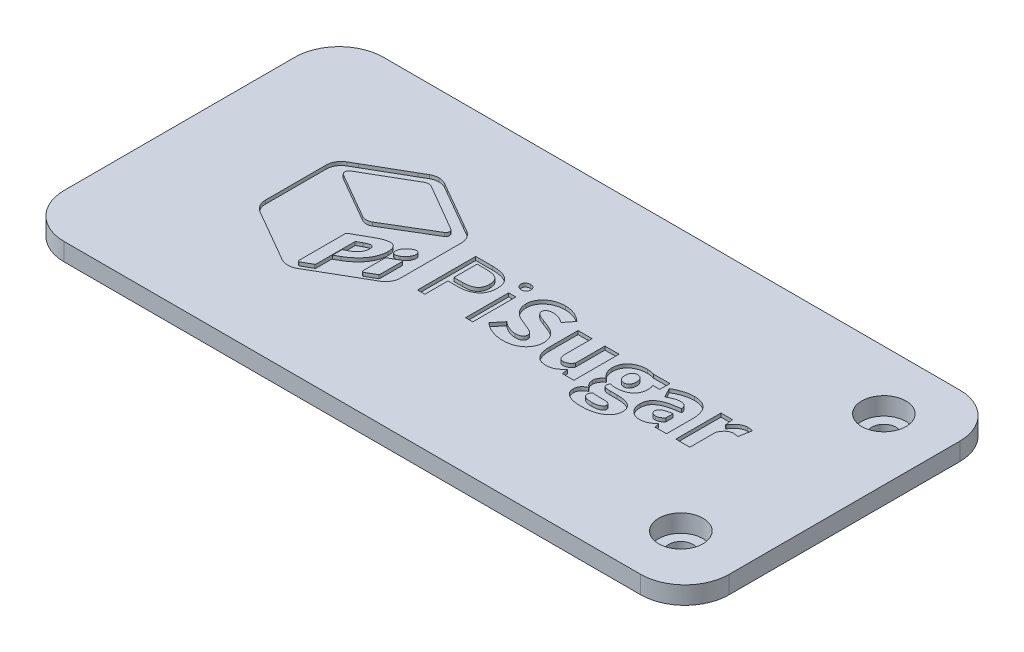
from build123d import *

# Parameters (mm, degrees)
EXTRUDE_2_DEPTH     = 2
EXTRUDE_3_DEPTH     = 1
SKETCH_4_W          = 4
SKETCH_4_H          = 10
EXTRUDE_7_DEPTH     = 2.2
SKETCH_10_R         = 3.5
EXTRUDE_10_DEPTH    = 3
SKETCH_9_R          = 2.5
CUT_EXTRUDE_3_DEPTH = 2
SKETCH_7_R          = 1.375
CUT_EXTRUDE_4_DEPTH = 4
SKETCH_12_W         = 10
SKETCH_12_H         = 1.2
EXTRUDE_11_DEPTH    = 6.7
CHAMFER_5_SIZE      = 1
CHAMFER_6_SIZE      = 1
CHAMFER_8_SIZE      = 1
SKETCH_14_W         = 0.815007944
SKETCH_14_H         = 4.86663949
CUT_EXTRUDE_8_DEPTH = 0.4


with BuildPart() as part:
    # case 2 → 凸台-拉伸2 (new body)
    with BuildSketch(Plane(origin=(0, 0, 0), x_dir=(1, 0, 0), z_dir=(0, 1, 0))):
        with BuildLine():
            Line((-34.042196447, 18), (30.957803553, 18))
            ThreePointArc((30.957803553, 18), (34.493337459, 16.535533906), (35.957803553, 13))
            Line((35.957803553, 13), (35.957803553, -13))
            ThreePointArc((35.957803553, -13), (34.493337459, -16.535533906), (30.957803553, -18))
            Line((30.957803553, -18), (-34.042196447, -18))
            ThreePointArc((-34.042196447, -18), (-37.577730353, -16.535533906), (-39.042196447, -13))
            Line((-39.042196447, -13), (-39.042196447, 13))
            ThreePointArc((-39.042196447, 13), (-37.577730353, 16.535533906), (-34.042196447, 18))
        make_face()
    extrude(amount=EXTRUDE_2_DEPTH)

    # 草图2 → 凸台-拉伸3 (add)
    with BuildSketch(Plane(origin=(0, 0, 0), x_dir=(1, 0, 0), z_dir=(0, 1, 0))):
        with BuildLine():
            Line((33.857803553, -13), (33.857803553, 13))
            ThreePointArc((33.857803553, 13), (32.913005401, 14.955201848), (30.957803553, 15.9))
            Line((30.957803553, 15.9), (-34.042196447, 15.9))
            ThreePointArc((-34.042196447, 15.9), (-35.997398295, 14.955201848), (-36.942196447, 13))
            Line((-36.942196447, 13), (-36.942196447, -13))
            ThreePointArc((-36.942196447, -13), (-35.997398295, -14.955201848), (-34.042196447, -15.9))
            Line((-34.042196447, -15.9), (30.957803553, -15.9))
            ThreePointArc((30.957803553, -15.9), (32.913005401, -14.955201848), (33.857803553, -13))
        make_face()
        with BuildLine():
            Line((-34.042196447, -14.7), (30.957803553, -14.7))
            ThreePointArc((30.957803553, -14.7), (32.036016745, -14.078213193), (32.657803553, -13))
            Line((32.657803553, -13), (32.657803553, 13))
            ThreePointArc((32.657803553, 13), (32.036016745, 14.078213193), (30.957803553, 14.7))
            Line((30.957803553, 14.7), (-34.042196447, 14.7))
            ThreePointArc((-34.042196447, 14.7), (-35.12040964, 14.078213193), (-35.742196447, 13))
            Line((-35.742196447, 13), (-35.742196447, -13))
            ThreePointArc((-35.742196447, -13), (-35.12040964, -14.078213193), (-34.042196447, -14.7))
        make_face(mode=Mode.SUBTRACT)
    extrude(amount=-EXTRUDE_3_DEPTH)

    # 草图4 → 凸台-拉伸7 (add)
    with BuildSketch(Plane(origin=(0, 0, 0), x_dir=(1, 0, 0), z_dir=(0, 1, 0))):
        with Locations((-33.742196447, 0)):
            Rectangle(SKETCH_4_W, SKETCH_4_H)
    extrude(amount=-EXTRUDE_7_DEPTH)

    # 草图10 → 凸台-拉伸10 (add)
    with BuildSketch(Plane(origin=(0, 2, 0), x_dir=(1, 0, 0), z_dir=(0, 1, 0))):
        with Locations((28.997803553, 11.4)):
            Circle(SKETCH_10_R)
        with Locations((28.997803553, -11.5)):
            Circle(SKETCH_10_R)
    extrude(amount=-EXTRUDE_10_DEPTH)

    # 草图9 → 切除-拉伸3 (cut)
    with BuildSketch(Plane(origin=(0, 2, 0), x_dir=(1, 0, 0), z_dir=(0, 1, 0))):
        with Locations((28.997803553, 11.4)):
            Circle(SKETCH_9_R)
        with Locations((28.997803553, -11.5)):
            Circle(SKETCH_9_R)
    extrude(amount=-CUT_EXTRUDE_3_DEPTH, mode=Mode.SUBTRACT)

    # 草图7 → 切除-拉伸4 (cut)
    with BuildSketch(Plane(origin=(0, 2, 0), x_dir=(1, 0, 0), z_dir=(0, 1, 0))):
        with Locations((28.997803553, 11.4)):
            Circle(SKETCH_7_R)
        with Locations((28.997803553, -11.5)):
            Circle(SKETCH_7_R)
    extrude(amount=-CUT_EXTRUDE_4_DEPTH, mode=Mode.SUBTRACT)

    # 草图12 → 凸台-拉伸11 (add)
    with BuildSketch(Plane(origin=(-31.742196447, 0, 0), x_dir=(0, 0, -1), z_dir=(1, 0, 0))):
        with Locations((0, -1.6)):
            Rectangle(SKETCH_12_W, SKETCH_12_H)
    extrude(amount=-EXTRUDE_11_DEPTH)

    # 倒角5
    chamfer_5_edges = [part.edges().sort_by_distance(p)[0] for p in [
        (-38.442196447, -1, 0),
    ]]
    chamfer(chamfer_5_edges, length=CHAMFER_5_SIZE)

    # 倒角6
    chamfer_6_edges = [part.edges().sort_by_distance(p)[0] for p in [
        (-33.742196447, 0, -5),
        (-31.742196447, 0, 0),
        (-33.742196447, 0, 5),
    ]]
    chamfer(chamfer_6_edges, length=CHAMFER_6_SIZE)

    # 倒角8
    chamfer_8_edges = [part.edges().sort_by_distance(p)[0] for p in [
        (-31.742196447, -2.2, 0),
    ]]
    chamfer(chamfer_8_edges, length=CHAMFER_8_SIZE)

    # 草图14 → 切除-拉伸8 (cut)
    # profile 1 of 9: a face of its own
    with BuildSketch(Plane(origin=(0, 2, 0), x_dir=(1, 0, 0), z_dir=(0, 1, 0))):
        with BuildLine():
            Line((-12.368120344, 5.71891476), (-13.188693381, 6.191912926))
            Line((-13.188693381, 6.191912926), (-17.445572533, 8.648032164))
            Line((-17.445572533, 8.648032164), (-18.26614557, 9.126734551))
            add(Edge.make_bspline(
                [(-18.26614557, 9.126734551), (-18.534035259, 9.274870384), (-18.830306925, 9.354659912), (-19.126648154, 9.354659912)],
                knots=[3, 3, 3, 3, 4, 4, 4, 4], degree=3))
            add(Edge.make_bspline(
                [(-19.126648154, 9.354659912), (-19.422989383, 9.354659912), (-19.719330613, 9.274870384), (-19.987150738, 9.126734551)],
                knots=[4, 4, 4, 4, 5, 5, 5, 5], degree=3))
            Line((-19.987150738, 9.126734551), (-20.807793339, 8.648032164))
            Line((-20.807793339, 8.648032164), (-25.06467249, 6.191912926))
            Line((-25.06467249, 6.191912926), (-25.885315091, 5.71891476))
            add(Edge.make_bspline(
                [(-25.885315091, 5.71891476), (-26.415251121, 5.411199871), (-26.745817675, 4.841334295), (-26.745817675, 4.231573956)],
                knots=[8, 8, 8, 8, 9, 9, 9, 9], degree=3))
            Line((-26.745817675, 4.231573956), (-26.745817675, -2.584030844))
            add(Edge.make_bspline(
                [(-26.745817675, -2.584030844), (-26.745817675, -3.199460623), (-26.415251121, -3.763656759), (-25.885315091, -4.071371648)],
                knots=[10, 10, 10, 10, 11, 11, 11, 11], degree=3))
            Line((-25.885315091, -4.071371648), (-25.06467249, -4.544369814))
            Line((-25.06467249, -4.544369814), (-20.807793339, -7.000489052))
            Line((-20.807793339, -7.000489052), (-19.987150738, -7.479156657))
            add(Edge.make_bspline(
                [(-19.987150738, -7.479156657), (-19.719330613, -7.633031493), (-19.422989383, -7.7071168), (-19.126648154, -7.7071168)],
                knots=[14, 14, 14, 14, 15, 15, 15, 15], degree=3))
            add(Edge.make_bspline(
                [(-19.126648154, -7.7071168), (-18.830306925, -7.7071168), (-18.534035259, -7.633031493), (-18.26614557, -7.479156657)],
                knots=[15, 15, 15, 15, 16, 16, 16, 16], degree=3))
            Line((-18.26614557, -7.479156657), (-17.445572533, -7.000489052))
            Line((-17.445572533, -7.000489052), (-13.188693381, -4.544369814))
            Line((-13.188693381, -4.544369814), (-12.368120344, -4.071371648))
            add(Edge.make_bspline(
                [(-12.368120344, -4.071371648), (-11.83241053, -3.763656759), (-11.50761776, -3.199460623), (-11.50761776, -2.584030844)],
                knots=[19, 19, 19, 19, 20, 20, 20, 20], degree=3))
            Line((-11.50761776, -2.584030844), (-11.50761776, 4.231573956))
            add(Edge.make_bspline(
                [(-11.50761776, 4.231573956), (-11.50761776, 4.841334295), (-11.83241053, 5.411199871), (-12.368120344, 5.71891476)],
                knots=[21, 21, 21, 21, 22, 22, 22, 22], degree=3))
        make_face()
        with BuildLine():
            Line((-24.791148144, 5.040773334), (-19.525595795, 8.083870809))
            add(Edge.make_bspline(
                [(-19.525595795, 8.083870809), (-19.280522989, 8.226337203), (-18.972773318, 8.226337203), (-18.722065856, 8.083870809)],
                knots=[3, 3, 3, 3, 4, 4, 4, 4], degree=3))
            Line((-18.722065856, 8.083870809), (-13.485034611, 5.035069113))
            add(Edge.make_bspline(
                [(-13.485034611, 5.035069113), (-13.217214486, 4.881229059), (-13.211510265, 4.493724642), (-13.47933039, 4.334145586)],
                knots=[5, 5, 5, 5, 6, 6, 6, 6], degree=3))
            Line((-13.47933039, 4.334145586), (-18.56819102, 1.291082892))
            add(Edge.make_bspline(
                [(-18.56819102, 1.291082892), (-18.910166017, 1.091609072), (-19.337565198, 1.091609072), (-19.67947063, 1.291082892)],
                knots=[7, 7, 7, 7, 8, 8, 8, 8], degree=3))
            add(Edge.make_bspline(
                [(-19.67947063, 1.291082892), (-24.831008126, 4.265764499), (-24.842416568, 4.27146872)],
                knots=[0, 0, 0, 1, 1, 1], degree=2))
            add(Edge.make_bspline(
                [(-24.842416568, 4.27146872), (-25.110236693, 4.465203538), (-25.081785153, 4.875524839), (-24.791148144, 5.040773334)],
                knots=[1, 1, 1, 1, 2, 2, 2, 2], degree=3))
        make_face(mode=Mode.SUBTRACT)
        with BuildLine():
            Line((-16.989652247, -3.866228388), (-17.582334706, -4.196725379))
            Line((-17.582334706, -4.196725379), (-17.582334706, -3.114001655))
            Line((-17.582334706, -3.114001655), (-17.058102897, -2.851850969))
            add(Edge.make_bspline(
                [(-16.100698123, -1.467081796), (-16.100698123, -2.008461048), (-16.40837823, -2.487128654), (-17.058102897, -2.851850969)],
                knots=[0, 0, 0, 0, 1, 1, 1, 1], degree=3))
            add(Edge.make_bspline(
                [(-17.092258659, -1.279016417), (-16.454011997, -0.914328883), (-16.100698123, -0.908624662), (-16.100698123, -1.467081796)],
                knots=[6, 6, 6, 6, 7, 7, 7, 7], degree=3))
            Line((-17.092258659, -1.279016417), (-17.582334706, -1.552575545))
            add(Edge.make_bspline(
                [(-17.639376914, -1.649442953), (-17.639376914, -1.609548189), (-17.616560031, -1.569653425), (-17.582334706, -1.552575545)],
                knots=[4, 4, 4, 4, 5, 5, 5, 5], degree=3))
            Line((-17.639376914, -1.649442953), (-17.639376914, -2.994317363))
            Line((-17.639376914, -2.994317363), (-17.639376914, -4.29362757))
            Line((-17.639376914, -4.29362757), (-17.639376914, -6.003224295))
            add(Edge.make_bspline(
                [(-17.639376914, -6.003224295), (-17.639376914, -6.043119059), (-17.656420013, -6.077309603), (-17.696279995, -6.100091704)],
                knots=[3, 3, 3, 3, 4, 4, 4, 4], degree=3))
            Line((-17.696279995, -6.100091704), (-18.801855384, -6.726929924))
            add(Edge.make_bspline(
                [(-18.801855384, -6.726929924), (-18.875940691, -6.766824688), (-18.967138661, -6.715556264), (-18.967138661, -6.630062515)],
                knots=[5, 5, 5, 5, 6, 6, 6, 6], degree=3))
            Line((-18.967138661, -6.630062515), (-18.967138661, -1.353101724))
            add(Edge.make_bspline(
                [(-18.967138661, -1.353101724), (-18.967138661, -1.31320696), (-18.950025999, -1.273312196), (-18.910166017, -1.256234315)],
                knots=[7, 7, 7, 7, 8, 8, 8, 8], degree=3))
            Line((-18.910166017, -1.256234315), (-17.029581793, -0.190588472))
            add(Edge.make_bspline(
                [(-17.029581793, -0.190588472), (-15.810061115, 0.498961395), (-14.80145748, 0.635723568), (-14.80145748, -0.731967725)],
                knots=[9, 9, 9, 9, 10, 10, 10, 10], degree=3))
            add(Edge.make_bspline(
                [(-14.80145748, -0.731967725), (-14.80145748, -2.048355812), (-15.821469556, -3.205164843), (-16.989652247, -3.866228388)],
                knots=[10, 10, 10, 10, 11, 11, 11, 11], degree=3))
        make_face(mode=Mode.SUBTRACT)
        with BuildLine():
            Line((-13.086156534, -3.512914514), (-14.180253917, -4.134048514))
            add(Edge.make_bspline(
                [(-14.180253917, -4.134048514), (-14.254339225, -4.173943278), (-14.345537194, -4.122640072), (-14.345537194, -4.037181105)],
                knots=[2, 2, 2, 2, 3, 3, 3, 3], degree=3))
            Line((-14.345537194, -4.037181105), (-14.345537194, -1.52405444))
            add(Edge.make_bspline(
                [(-14.345537194, -1.52405444), (-14.345537194, -1.484194458), (-14.322720311, -1.449969133), (-14.288494986, -1.427187031)],
                knots=[4, 4, 4, 4, 5, 5, 5, 5], degree=3))
            Line((-14.288494986, -1.427187031), (-13.194397602, -0.811722471))
            add(Edge.make_bspline(
                [(-13.194397602, -0.811722471), (-13.120312295, -0.771862489), (-13.029114325, -0.823130913), (-13.029114325, -0.908624662)],
                knots=[6, 6, 6, 6, 7, 7, 7, 7], degree=3))
            Line((-13.029114325, -0.908624662), (-13.029114325, -3.416012324))
            add(Edge.make_bspline(
                [(-13.029114325, -3.416012324), (-13.029114325, -3.455907088), (-13.051931209, -3.495801852), (-13.086156534, -3.512914514)],
                knots=[0, 0, 0, 0, 1, 1, 1, 1], degree=3))
        make_face(mode=Mode.SUBTRACT)
        with BuildLine():
            add(Edge.make_bspline(
                [(-13.684473649, 0.85797949), (-13.245666026, 1.108721734), (-12.932281698, 1.000445884), (-12.932281698, 0.601533025), (-12.932281698, 0.208324387), (-13.245666026, -0.253265338), (-13.684473649, -0.498303361)],
                knots=[2, 2, 2, 2, 3, 3, 3, 4, 4, 4, 4], degree=3))
            add(Edge.make_bspline(
                [(-13.684473649, -0.498303361), (-14.12891593, -0.754749827), (-14.442369821, -0.646473976), (-14.442369821, -0.253265338), (-14.442369821, 0.151351742), (-14.12891593, 0.607237246), (-13.684473649, 0.85797949)],
                knots=[0, 0, 0, 0, 1, 1, 1, 2, 2, 2, 2], degree=3))
        make_face(mode=Mode.SUBTRACT)
    # profile 2 of 9: a face of its own
    with BuildSketch(Plane(origin=(0, 2, 0), x_dir=(1, 0, 0), z_dir=(0, 1, 0))):
        with BuildLine():
            Line((-7.512854513, 3.752871569), (-9.387734516, 3.752871569))
            Line((-9.387734516, 3.752871569), (-9.387734516, -2.811956205))
            Line((-9.387734516, -2.811956205), (-8.555683473, -2.811956205))
            Line((-8.555683473, -2.811956205), (-8.555683473, -0.207666353))
            Line((-8.555683473, -0.207666353), (-7.467220746, -0.207666353))
            add(Edge.make_bspline(
                [(-7.467220746, -0.207666353), (-6.036852588, -0.207666353), (-5.050996273, 0.441953969), (-5.050996273, 1.826757924)],
                knots=[5, 5, 5, 5, 6, 6, 6, 6], degree=3))
            add(Edge.make_bspline(
                [(-5.050996273, 1.826757924), (-5.050996273, 3.262795522), (-6.036852588, 3.752871569), (-7.512854513, 3.752871569)],
                knots=[6, 6, 6, 6, 7, 7, 7, 7], degree=3))
        make_face()
        with BuildLine():
            Line((-7.575461815, 0.464770852), (-8.555683473, 0.464770852))
            Line((-8.555683473, 0.464770852), (-8.555683473, 3.080434364))
            Line((-8.555683473, 3.080434364), (-7.60968714, 3.080434364))
            add(Edge.make_bspline(
                [(-7.60968714, 3.080434364), (-6.458547548, 3.080434364), (-5.877273531, 2.778423696), (-5.877273531, 1.826757924)],
                knots=[3, 3, 3, 3, 4, 4, 4, 4], degree=3))
            add(Edge.make_bspline(
                [(-5.877273531, 1.826757924), (-5.877273531, 0.886465812), (-6.418687566, 0.464770852), (-7.575461815, 0.464770852)],
                knots=[4, 4, 4, 4, 5, 5, 5, 5], degree=3))
        make_face(mode=Mode.SUBTRACT)
    # profile 3 of 9: a face of its own
    with BuildSketch(Plane(origin=(0, 2, 0), x_dir=(1, 0, 0), z_dir=(0, 1, 0))):
        with Locations((-3.56650758, -0.37863646)):
            Rectangle(SKETCH_14_W, SKETCH_14_H)
    # profile 4 of 9: a face of its own
    with BuildSketch(Plane(origin=(0, 2, 0), x_dir=(1, 0, 0), z_dir=(0, 1, 0))):
        with BuildLine():
            Line((1.548022045, 0.977629), (0.716040565, 1.308160773))
            add(Edge.make_bspline(
                [(0.716040565, 1.308160773), (0.129062328, 1.541825137), (-0.292632633, 1.68429153), (-0.292632633, 2.054683285)],
                knots=[1, 1, 1, 1, 2, 2, 2, 2], degree=3))
            add(Edge.make_bspline(
                [(-0.292632633, 2.054683285), (-0.292632633, 2.407997159), (0.009412817, 2.60747098), (0.505193085, 2.60747098)],
                knots=[2, 2, 2, 2, 3, 3, 3, 3], degree=3))
            add(Edge.make_bspline(
                [(0.505193085, 2.60747098), (1.023720673, 2.60747098), (1.434076755, 2.430814043), (1.872814814, 2.094578049)],
                knots=[3, 3, 3, 3, 4, 4, 4, 4], degree=3))
            Line((1.872814814, 2.094578049), (2.670710096, 3.097547027))
            add(Edge.make_bspline(
                [(2.670710096, 3.097547027), (2.089436079, 3.684490482), (1.274497699, 3.980831712), (0.505193085, 3.980831712)],
                knots=[5, 5, 5, 5, 6, 6, 6, 6], degree=3))
            add(Edge.make_bspline(
                [(0.505193085, 3.980831712), (-0.913766632, 3.980831712), (-1.916735609, 3.080434364), (-1.916735609, 1.963520097)],
                knots=[6, 6, 6, 6, 7, 7, 7, 7], degree=3))
            add(Edge.make_bspline(
                [(-1.916735609, 1.963520097), (-1.916735609, 0.994741663), (-1.261445849, 0.413467646), (-0.560452758, 0.134239079)],
                knots=[7, 7, 7, 7, 8, 8, 8, 8], degree=3))
            Line((-0.560452758, 0.134239079), (0.288641384, -0.224779016))
            add(Edge.make_bspline(
                [(0.288641384, -0.224779016), (0.858506959, -0.464112818), (1.228933496, -0.589501331), (1.228933496, -0.977005749)],
                knots=[9, 9, 9, 9, 10, 10, 10, 10], degree=3))
            add(Edge.make_bspline(
                [(1.228933496, -0.977005749), (1.228933496, -1.336023843), (0.949704929, -1.558244984), (0.35702247, -1.558244984)],
                knots=[10, 10, 10, 10, 11, 11, 11, 11], degree=3))
            add(Edge.make_bspline(
                [(0.35702247, -1.558244984), (-0.167209338, -1.558244984), (-0.788412901, -1.279016417), (-1.261445849, -0.874434119)],
                knots=[11, 11, 11, 11, 12, 12, 12, 12], degree=3))
            Line((-1.261445849, -0.874434119), (-2.167443072, -1.979974726))
            add(Edge.make_bspline(
                [(-2.167443072, -1.979974726), (-1.477927986, -2.612517167), (-0.543409659, -2.937344718), (0.322797145, -2.937344718)],
                knots=[13, 13, 13, 13, 14, 14, 14, 14], degree=3))
            add(Edge.make_bspline(
                [(0.322797145, -2.937344718), (1.935561244, -2.937344718), (2.870079571, -1.962862063), (2.870079571, -0.851617235)],
                knots=[14, 14, 14, 14, 15, 15, 15, 15], degree=3))
            add(Edge.make_bspline(
                [(2.870079571, -0.851617235), (2.870079571, 0.088640094), (2.374368867, 0.64713201), (1.548022045, 0.977629)],
                knots=[15, 15, 15, 15, 16, 16, 16, 16], degree=3))
        make_face()
    # profile 5 of 9: a face of its own
    with BuildSketch(Plane(origin=(0, 2, 0), x_dir=(1, 0, 0), z_dir=(0, 1, 0))):
        with BuildLine():
            Line((6.654064901, 2.282643428), (6.654064901, -1.056795277))
            add(Edge.make_bspline(
                [(6.654064901, -1.056795277), (6.386244776, -1.432891252), (6.163919291, -1.575357646), (5.80497076, -1.575357646)],
                knots=[1, 1, 1, 1, 2, 2, 2, 2], degree=3))
            add(Edge.make_bspline(
                [(5.80497076, -1.575357646), (5.400318898, -1.575357646), (5.212288301, -1.375918608), (5.212288301, -0.669256078)],
                knots=[2, 2, 2, 2, 3, 3, 3, 3], degree=3))
            Line((5.212288301, -0.669256078), (5.212288301, 2.282643428))
            Line((5.212288301, 2.282643428), (3.622341086, 2.282643428))
            Line((3.622341086, 2.282643428), (3.622341086, -0.868729898))
            add(Edge.make_bspline(
                [(3.622341086, -0.868729898), (3.622341086, -2.139519), (4.095374034, -2.937344718), (5.20658408, -2.937344718)],
                knots=[6, 6, 6, 6, 7, 7, 7, 7], degree=3))
            add(Edge.make_bspline(
                [(5.20658408, -2.937344718), (5.901803387, -2.937344718), (6.380540556, -2.612517167), (6.802235516, -2.111032678)],
                knots=[7, 7, 7, 7, 8, 8, 8, 8], degree=3))
            Line((6.802235516, -2.111032678), (6.836391277, -2.111032678))
            Line((6.836391277, -2.111032678), (6.950406131, -2.811956205))
            Line((6.950406131, -2.811956205), (8.249646774, -2.811956205))
            Line((8.249646774, -2.811956205), (8.249646774, 2.282643428))
            Line((8.249646774, 2.282643428), (6.654064901, 2.282643428))
        make_face()
    # profile 6 of 9: a face of its own
    with BuildSketch(Plane(origin=(0, 2, 0), x_dir=(1, 0, 0), z_dir=(0, 1, 0))):
        with BuildLine():
            Line((12.101943627, -1.808987228), (11.298413688, -1.808987228))
            add(Edge.make_bspline(
                [(11.298413688, -1.808987228), (10.751364996, -1.808987228), (10.546221737, -1.700711377), (10.546221737, -1.467081796)],
                knots=[1, 1, 1, 1, 2, 2, 2, 2], degree=3))
            add(Edge.make_bspline(
                [(10.546221737, -1.467081796), (10.546221737, -1.296129079), (10.586081719, -1.216339551), (10.70573123, -1.108063701)],
                knots=[2, 2, 2, 2, 3, 3, 3, 3], degree=3))
            add(Edge.make_bspline(
                [(10.70573123, -1.108063701), (10.928056715, -1.170740566), (11.133130411, -1.199261671), (11.304117909, -1.199261671)],
                knots=[3, 3, 3, 3, 4, 4, 4, 4], degree=3))
            add(Edge.make_bspline(
                [(11.304117909, -1.199261671), (12.432440618, -1.199261671), (13.338576968, -0.680664519), (13.338576968, 0.510335055)],
                knots=[4, 4, 4, 4, 5, 5, 5, 5], degree=3))
            add(Edge.make_bspline(
                [(13.338576968, 0.510335055), (13.338576968, 0.75540786), (13.275830539, 0.989037442), (13.196110574, 1.131503836)],
                knots=[5, 5, 5, 5, 6, 6, 6, 6], degree=3))
            Line((13.196110574, 1.131503836), (13.982458287, 1.131503836))
            Line((13.982458287, 1.131503836), (13.982458287, 2.282643428))
            Line((13.982458287, 2.282643428), (12.113352069, 2.282643428))
            add(Edge.make_bspline(
                [(12.113352069, 2.282643428), (11.879687705, 2.368102395), (11.600459138, 2.407997159), (11.304117909, 2.407997159)],
                knots=[9, 9, 9, 9, 10, 10, 10, 10], degree=3))
            add(Edge.make_bspline(
                [(11.304117909, 2.407997159), (10.204316305, 2.407997159), (9.172826223, 1.803941041), (9.172826223, 0.55593404)],
                knots=[10, 10, 10, 10, 11, 11, 11, 11], degree=3))
            add(Edge.make_bspline(
                [(9.172826223, 0.55593404), (9.172826223, -0.036713637), (9.503392777, -0.509711803), (9.862341309, -0.760454047)],
                knots=[11, 11, 11, 11, 12, 12, 12, 12], degree=3))
            Line((9.862341309, -0.760454047), (9.862341309, -0.794644591))
            add(Edge.make_bspline(
                [(9.862341309, -0.794644591), (9.531844318, -1.028274173), (9.298179954, -1.387292267), (9.298179954, -1.746310362)],
                knots=[13, 13, 13, 13, 14, 14, 14, 14], degree=3))
            add(Edge.make_bspline(
                [(9.298179954, -1.746310362), (9.298179954, -2.173709544), (9.497688556, -2.441564451), (9.765508681, -2.623925608)],
                knots=[14, 14, 14, 14, 15, 15, 15, 15], degree=3))
            Line((9.765508681, -2.623925608), (9.765508681, -2.669489812))
            add(Edge.make_bspline(
                [(9.765508681, -2.669489812), (9.292475733, -2.908858396), (9.041768271, -3.250763828), (9.041768271, -3.672458789)],
                knots=[16, 16, 16, 16, 17, 17, 17, 17], degree=3))
            add(Edge.make_bspline(
                [(9.041768271, -3.672458789), (9.041768271, -4.584229796), (10.004807702, -4.954656333), (11.178764178, -4.954656333)],
                knots=[17, 17, 17, 17, 18, 18, 18, 18], degree=3))
            add(Edge.make_bspline(
                [(11.178764178, -4.954656333), (12.951037769, -4.954656333), (14.062317379, -4.19105594), (14.062317379, -3.114001655)],
                knots=[18, 18, 18, 18, 19, 19, 19, 19], degree=3))
            add(Edge.make_bspline(
                [(14.062317379, -3.114001655), (14.062317379, -2.190822206), (13.355689631, -1.808987228), (12.101943627, -1.808987228)],
                knots=[19, 19, 19, 19, 20, 20, 20, 20], degree=3))
        make_face()
        with BuildLine():
            Line((11.315526351, -3.028507906), (11.79996774, -3.028507906))
            add(Edge.make_bspline(
                [(11.79996774, -3.028507906), (12.272861561, -3.028507906), (12.54075125, -3.091184772), (12.54075125, -3.393230222)],
                knots=[4, 4, 4, 4, 5, 5, 5, 5], degree=3))
            add(Edge.make_bspline(
                [(12.54075125, -3.393230222), (12.54075125, -3.718057774), (12.084900528, -3.957391577), (11.42947164, -3.957391577)],
                knots=[5, 5, 5, 5, 6, 6, 6, 6], degree=3))
            add(Edge.make_bspline(
                [(11.42947164, -3.957391577), (10.77418188, -3.957391577), (10.346782698, -3.780734639), (10.346782698, -3.421716545)],
                knots=[0, 0, 0, 0, 1, 1, 1, 1], degree=3))
            add(Edge.make_bspline(
                [(10.346782698, -3.421716545), (10.346782698, -3.250763828), (10.426502663, -3.108297435), (10.586081719, -2.965831041)],
                knots=[1, 1, 1, 1, 2, 2, 2, 2], degree=3))
            add(Edge.make_bspline(
                [(10.586081719, -2.965831041), (10.751364996, -3.011430026), (10.945169378, -3.028507906), (11.315526351, -3.028507906)],
                knots=[2, 2, 2, 2, 3, 3, 3, 3], degree=3))
        make_face(mode=Mode.SUBTRACT)
        with BuildLine():
            add(Edge.make_bspline(
                [(11.304117909, -0.241856896), (10.939465157, -0.241856896), (10.66023659, 0.025963229), (10.66023659, 0.55593404), (10.66023659, 1.074531191), (10.939465157, 1.342351316), (11.304117909, 1.342351316)],
                knots=[2, 2, 2, 2, 3, 3, 3, 4, 4, 4, 4], degree=3))
            add(Edge.make_bspline(
                [(11.304117909, 1.342351316), (11.680248666, 1.342351316), (11.948068791, 1.074531191), (11.948068791, 0.55593404), (11.948068791, 0.025963229), (11.680248666, -0.241856896), (11.304117909, -0.241856896)],
                knots=[0, 0, 0, 0, 1, 1, 1, 2, 2, 2, 2], degree=3))
        make_face(mode=Mode.SUBTRACT)
    # profile 7 of 9: a face of its own
    with BuildSketch(Plane(origin=(0, 2, 0), x_dir=(1, 0, 0), z_dir=(0, 1, 0))):
        with BuildLine():
            Line((14.438378572, 1.741264175), (14.996835706, 0.692696213))
            add(Edge.make_bspline(
                [(14.996835706, 0.692696213), (15.504093979, 0.977629), (15.92578894, 1.137208057), (16.330371238, 1.137208057)],
                knots=[2, 2, 2, 2, 3, 3, 3, 3], degree=3))
            add(Edge.make_bspline(
                [(16.330371238, 1.137208057), (16.848898825, 1.137208057), (17.06552009, 0.897874254), (17.099675851, 0.487552953)],
                knots=[3, 3, 3, 3, 4, 4, 4, 4], degree=3))
            add(Edge.make_bspline(
                [(17.099675851, 0.487552953), (15.110850559, 0.271001252), (14.267391074, -0.310237983), (14.267391074, -1.387292267)],
                knots=[4, 4, 4, 4, 5, 5, 5, 5], degree=3))
            add(Edge.make_bspline(
                [(14.267391074, -1.387292267), (14.267391074, -2.236386409), (14.84296087, -2.937344718), (15.783322546, -2.937344718)],
                knots=[5, 5, 5, 5, 6, 6, 6, 6], degree=3))
            add(Edge.make_bspline(
                [(15.783322546, -2.937344718), (16.3474839, -2.937344718), (16.820447285, -2.675194032), (17.242142245, -2.299098057)],
                knots=[6, 6, 6, 6, 7, 7, 7, 7], degree=3))
            Line((17.242142245, -2.299098057), (17.282002227, -2.299098057))
            Line((17.282002227, -2.299098057), (17.395947517, -2.811956205))
            Line((17.395947517, -2.811956205), (18.695257724, -2.811956205))
            Line((18.695257724, -2.811956205), (18.695257724, 0.082935874))
            add(Edge.make_bspline(
                [(18.695257724, 0.082935874), (18.695257724, 1.67858731), (17.948769993, 2.407997159), (16.632416688, 2.407997159)],
                knots=[11, 11, 11, 11, 12, 12, 12, 12], degree=3))
            add(Edge.make_bspline(
                [(16.632416688, 2.407997159), (15.840225627, 2.407997159), (15.110850559, 2.140177034), (14.438378572, 1.741264175)],
                knots=[0, 0, 0, 0, 1, 1, 1, 1], degree=3))
        make_face()
        with BuildLine():
            Line((17.099675851, -0.481225481), (17.099675851, -1.296129079))
            add(Edge.make_bspline(
                [(17.099675851, -1.296129079), (16.866011488, -1.546871324), (16.655164007, -1.700711377), (16.330371238, -1.700711377)],
                knots=[0, 0, 0, 0, 1, 1, 1, 1], degree=3))
            add(Edge.make_bspline(
                [(16.330371238, -1.700711377), (15.999804683, -1.700711377), (15.783322546, -1.558244984), (15.783322546, -1.261938536)],
                knots=[1, 1, 1, 1, 2, 2, 2, 2], degree=3))
            add(Edge.make_bspline(
                [(15.783322546, -1.261938536), (15.783322546, -0.902920441), (16.108115316, -0.617987654), (17.099675851, -0.481225481)],
                knots=[2, 2, 2, 2, 3, 3, 3, 3], degree=3))
        make_face(mode=Mode.SUBTRACT)
    # profile 8 of 9: a face of its own
    with BuildSketch(Plane(origin=(0, 2, 0), x_dir=(1, 0, 0), z_dir=(0, 1, 0))):
        with BuildLine():
            Line((21.185637068, 1.399358743), (21.151411743, 1.399358743))
            Line((21.151411743, 1.399358743), (21.043170674, 2.282643428))
            Line((21.043170674, 2.282643428), (19.743860468, 2.282643428))
            Line((19.743860468, 2.282643428), (19.743860468, -2.811956205))
            Line((19.743860468, -2.811956205), (21.328103462, -2.811956205))
            Line((21.328103462, -2.811956205), (21.328103462, 0.100048536))
            add(Edge.make_bspline(
                [(21.328103462, 0.100048536), (21.595923587, 0.772485741), (22.051843873, 1.011819544), (22.427905066, 1.011819544)],
                knots=[7, 7, 7, 7, 8, 8, 8, 8], degree=3))
            add(Edge.make_bspline(
                [(22.427905066, 1.011819544), (22.655865209, 1.011819544), (22.804035824, 0.977629), (22.9863622, 0.932064797)],
                knots=[8, 8, 8, 8, 9, 9, 9, 9], degree=3))
            Line((22.9863622, 0.932064797), (23.254182325, 2.305425529))
            add(Edge.make_bspline(
                [(23.254182325, 2.305425529), (23.111715931, 2.368102395), (22.940797997, 2.407997159), (22.638752547, 2.407997159)],
                knots=[10, 10, 10, 10, 11, 11, 11, 11], degree=3))
            add(Edge.make_bspline(
                [(22.638752547, 2.407997159), (22.125859616, 2.407997159), (21.561698262, 2.077465387), (21.185637068, 1.399358743)],
                knots=[0, 0, 0, 0, 1, 1, 1, 1], degree=3))
        make_face()
    # profile 9 of 9: a face of its own
    with BuildSketch(Plane(origin=(0, 2, 0), x_dir=(1, 0, 0), z_dir=(0, 1, 0))):
        with BuildLine():
            add(Edge.make_bspline(
                [(-3.563655469, 3.057652263), (-3.238862699, 3.057652263), (-2.999494115, 3.279908184), (-2.999494115, 3.581918853), (-2.999494115, 3.918154846), (-3.238862699, 4.111889664), (-3.563655469, 4.111889664)],
                knots=[2, 2, 2, 2, 3, 3, 3, 4, 4, 4, 4], degree=3))
            add(Edge.make_bspline(
                [(-3.563655469, 4.111889664), (-3.888448239, 4.111889664), (-4.127816824, 3.918154846), (-4.127816824, 3.581918853), (-4.127816824, 3.279908184), (-3.888448239, 3.057652263), (-3.563655469, 3.057652263)],
                knots=[0, 0, 0, 0, 1, 1, 1, 2, 2, 2, 2], degree=3))
        make_face()
    extrude(amount=-CUT_EXTRUDE_8_DEPTH, mode=Mode.SUBTRACT)


solid = part.part
